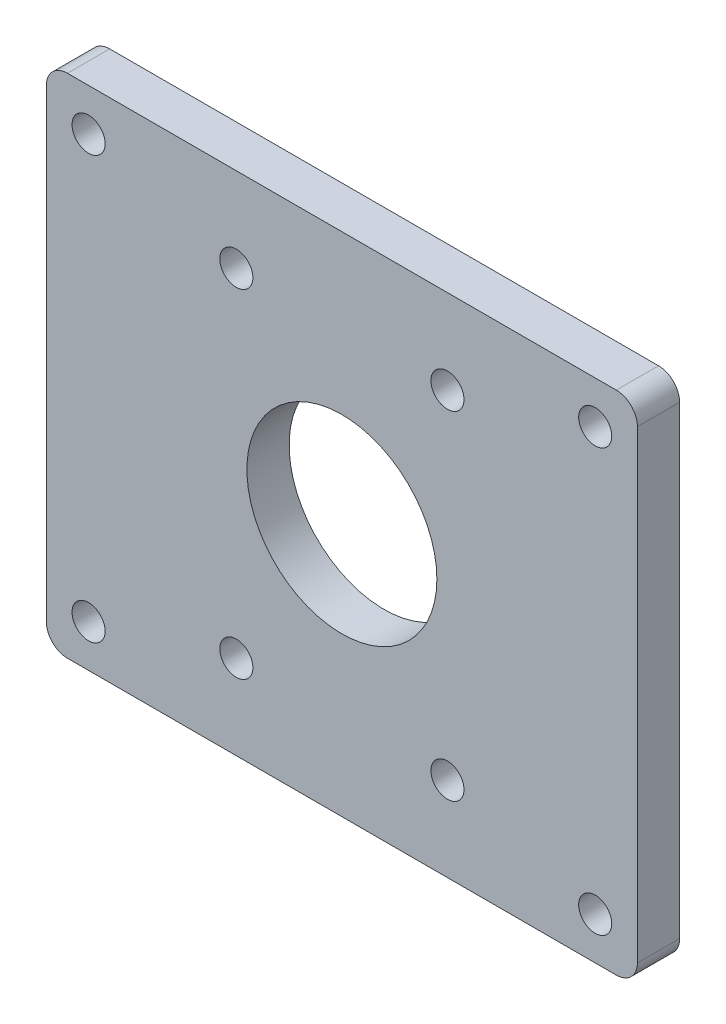
from build123d import *

# Parameters (mm, degrees)
SKETCH1_W           = 88.9
SKETCH1_H           = 76.2
SKETCH1_R           = 14.2875
SKETCH1_R_2         = 2.4892
BOSS_EXTRUDE1_DEPTH = 6.35
FILLET1_R           = 3.175


with BuildPart() as part:
    # Sketch1 → Boss-Extrude1 (new body)
    with BuildSketch(Plane.XY):
        Rectangle(SKETCH1_W, SKETCH1_H)
        Circle(SKETCH1_R, mode=Mode.SUBTRACT)
        with Locations((-15.875, -25.4)):
            Circle(SKETCH1_R_2, mode=Mode.SUBTRACT)
        with Locations((15.875, -25.4)):
            Circle(SKETCH1_R_2, mode=Mode.SUBTRACT)
        with Locations((15.875, 25.4)):
            Circle(SKETCH1_R_2, mode=Mode.SUBTRACT)
        with Locations((-15.875, 25.4)):
            Circle(SKETCH1_R_2, mode=Mode.SUBTRACT)
        with Locations((-38.1, 31.75)):
            Circle(SKETCH1_R_2, mode=Mode.SUBTRACT)
        with Locations((-38.1, -31.75)):
            Circle(SKETCH1_R_2, mode=Mode.SUBTRACT)
        with Locations((38.1, -31.75)):
            Circle(SKETCH1_R_2, mode=Mode.SUBTRACT)
        with Locations((38.1, 31.75)):
            Circle(SKETCH1_R_2, mode=Mode.SUBTRACT)
    extrude(amount=BOSS_EXTRUDE1_DEPTH)

    # Fillet1
    fillet1_edges = [part.edges().sort_by_distance(p)[0] for p in [
        (44.45, -38.1, 3.175),
        (-44.45, -38.1, 3.175),
        (-44.45, 38.1, 3.175),
        (44.45, 38.1, 3.175),
    ]]
    fillet(fillet1_edges, radius=FILLET1_R)


solid = part.part
